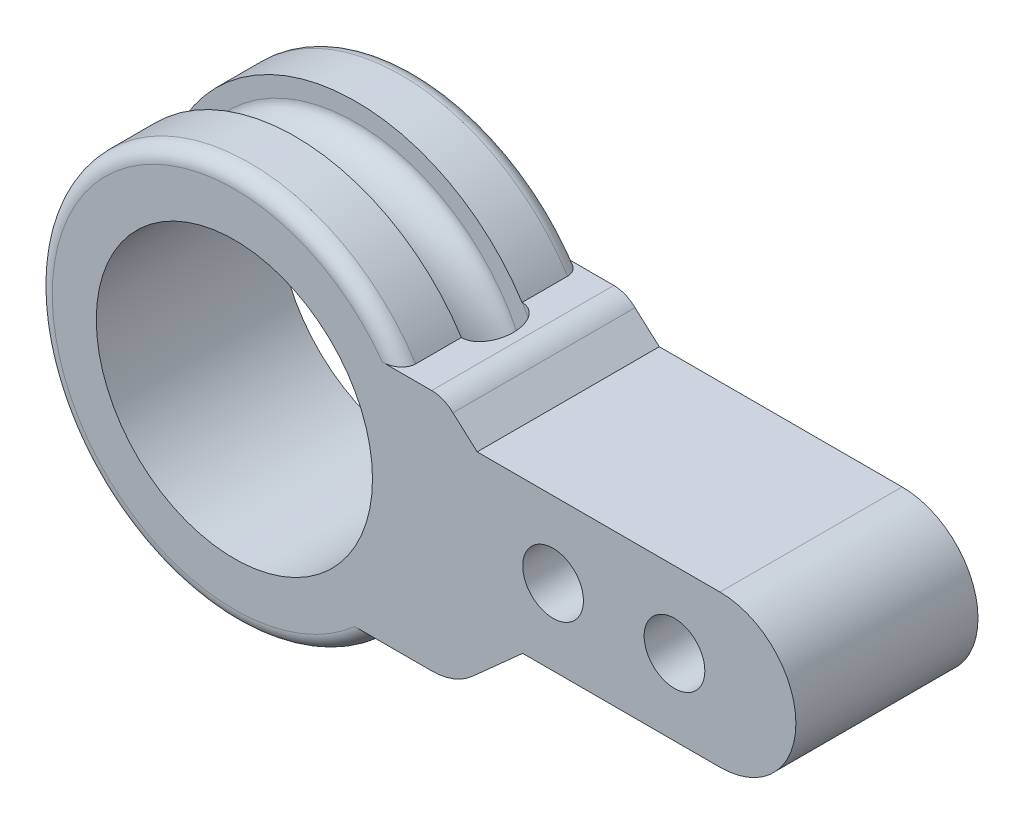
from build123d import *

# Parameters (mm, degrees)
BOSS_EXTRUDE1_DEPTH = 6
SKETCH1_5_R         = 4.55
CUT_EXTRUDE2_DEPTH  = 21.506096654
SKETCH1_6_R         = 1
CUT_EXTRUDE3_DEPTH  = 21.506096654
FILLET6_R           = 0.5
FILLET7_R           = 0.5


with BuildPart() as part:
    # Sketch1 → Boss-Extrude1 (new body)
    with BuildSketch(Plane.XY):
        with BuildLine():
            Line((9.5, -2.5), (16, -2.5))
            ThreePointArc((16, -2.5), (18.5, 0), (16, 2.5))
            Line((16, 2.5), (8, 2.5))
            Line((8, 2.5), (7.201136344, 3.213027227))
            ThreePointArc((7.201136344, 3.213027227), (6.878795969, 3.425480207), (6.5, 3.5))
            Line((6.5, 3.5), (5.477225575, 3.5))
            ThreePointArc((5.477225575, 3.5), (-6.468789112, 0.636213346), (4.69041576, -4.5))
            Line((4.69041576, -4.5), (6.5, -4.5))
            ThreePointArc((6.5, -4.5), (7.21364418, -4.368344718), (7.833333333, -3.990711985))
            Line((7.833333333, -3.990711985), (9.5, -2.5))
        make_face()
    extrude(amount=BOSS_EXTRUDE1_DEPTH)

    # Sketch1<5> → Cut-Extrude2 (cut, through all)
    with BuildSketch(Plane.XY):
        Circle(SKETCH1_5_R)
    extrude(amount=CUT_EXTRUDE2_DEPTH, mode=Mode.SUBTRACT)

    # Sketch1<6> → Cut-Extrude3 (cut, through all)
    with BuildSketch(Plane.XY):
        with Locations((14.5, 0)):
            Circle(SKETCH1_6_R)
        with Locations((10.5, 0)):
            Circle(SKETCH1_6_R)
    extrude(amount=CUT_EXTRUDE3_DEPTH, mode=Mode.SUBTRACT)

    # Sketch5 → Cut-Revolve2 (revolve, cut)
    with BuildSketch(Plane(origin=(0, 0, 0), x_dir=(0, 0, -1), z_dir=(1, 0, 0))):
        with BuildLine():
            Line((-3.998431193, 6.509033472), (-3.998431193, 5.899033472))
            add(Edge.make_bspline(
                [(-3.998431193, 5.899033472), (-3.998431193, 5.299033472), (-2.998431193, 5.299033472), (-1.998431193, 5.299033472), (-1.998431193, 5.899033472)],
                knots=[0, 0, 0, 1.570796327, 1.570796327, 3.141592654, 3.141592654, 3.141592654], degree=2, weights=[1, 0.707106781, 1, 0.707106781, 1]))
            Line((-1.998431193, 5.899033472), (-1.998431193, 6.509033472))
            add(Edge.make_bspline(
                [(-1.998431193, 6.509033472), (-1.998431193, 7.109033472), (-2.998431193, 7.109033472), (-3.998431193, 7.109033472), (-3.998431193, 6.509033472)],
                knots=[3.141592654, 3.141592654, 3.141592654, 4.71238898, 4.71238898, 6.283185307, 6.283185307, 6.283185307], degree=2, weights=[1, 0.707106781, 1, 0.707106781, 1]))
        make_face()
    revolve(axis=Axis((0, 0, 6.969963605), (0, 0, -1)), mode=Mode.SUBTRACT)

    # Fillet6
    fillet6_edges = [part.edges().sort_by_distance(p)[0] for p in [
        (-6.468789112, 0.636213346, 6),
    ]]
    fillet(fillet6_edges, radius=FILLET6_R)

    # Fillet7
    fillet7_edges = [part.edges().sort_by_distance(p)[0] for p in [
        (-6.468789112, 0.636213346, 0),
    ]]
    fillet(fillet7_edges, radius=FILLET7_R)


solid = part.part
